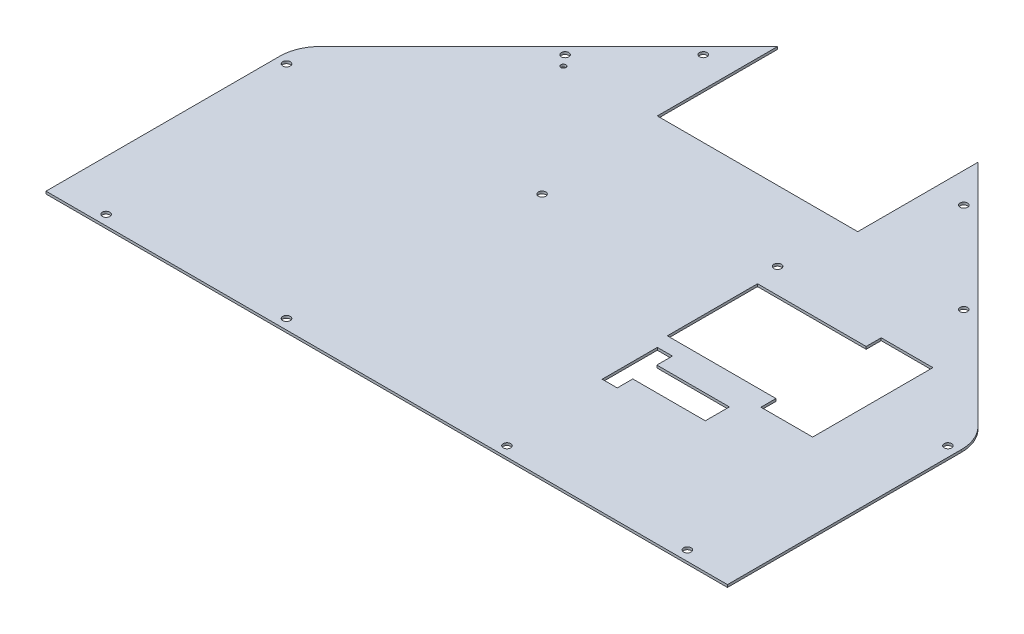
from build123d import *

# Parameters (mm, degrees)
EXTRUDE1_DEPTH     = 1.5875
MIRROR1_DEPTH      = 1.5875
CUT_EXTRUDE1_REACH = 534.229
SKETCH3_R          = 1.5875
CUT_EXTRUDE2_DEPTH = 533.229351555
SKETCH4_R          = 2.38125
SKETCH4_R_2        = 2.381250001
CUT_EXTRUDE3_DEPTH = 533.229351555
CUT_EXTRUDE4_DEPTH = 533.229351555
FILLET1_R          = 25.4


# Read off the part's stored shape, not the designer's step: Mirror1
with BuildPart() as part:
    # Sketch1 → Extrude1 (new body)
    with BuildSketch(Plane(origin=(0, 0, 0), x_dir=(1, 0, 0), z_dir=(0, 1, 0))):
        Polygon((0, 0), (0, 158.75), (152.4, 311.15), (152.4, 234.95), (215.9, 234.95), (215.9, 0), align=None)
    extrude(amount=EXTRUDE1_DEPTH)

    # Mirror1 outline → Mirror1 (add)
    with BuildSketch(Plane(origin=(0, 0, 0), x_dir=(1, 0, 0), z_dir=(0, 1, 0))):
        Polygon((215.9, 0), (431.8, 0), (431.8, 158.75), (279.4, 311.15), (279.4, 234.95), (215.9, 234.95), align=None)
    extrude(amount=MIRROR1_DEPTH)

    # Sketch2 → Cut-Extrude1 (cut, up to next)
    with BuildSketch(Plane(origin=(0, 1.5875, 0), x_dir=(-1, 0, 0), z_dir=(0, 1, 0)), mode=Mode.PRIVATE) as cut_extrude1_sk1:
        Polygon((-276.225, -174.625), (-345.059, -174.625), (-345.059, -184.15), (-377.825, -184.15), (-377.825, -107.95), (-345.059, -107.95), (-345.059, -117.475), (-276.225, -117.475), align=None)
    cut_extrude1_tool1 = extrude(cut_extrude1_sk1.sketch, amount=-CUT_EXTRUDE1_REACH, mode=Mode.PRIVATE) & part.part
    add(cut_extrude1_tool1.solids().sort_by_distance((330.365702, 1.5875, -146.05))[0], mode=Mode.SUBTRACT)

    # Sketch3 → Cut-Extrude2 (cut, through all)
    with BuildSketch(Plane.XZ):
        with Locations(Location((95.31871999, -232.5161053, 0), (0, 0, 270))):
            Circle(SKETCH3_R)
    extrude(amount=-CUT_EXTRUDE2_DEPTH, mode=Mode.SUBTRACT)

    # Sketch4 → Cut-Extrude3 (cut, through all)
    with BuildSketch(Plane.XZ):
        with Locations(Location((133.35, -283.119743879, 0), (0, 0, 270))):
            Circle(SKETCH4_R)
        with Locations(Location((273.05, -190.5, 0), (0, 0, 270))):
            Circle(SKETCH4_R)
        with Locations(Location((158.75, -155.575, 0), (0, 0, 270))):
            Circle(SKETCH4_R)
        with Locations(Location((298.45, -283.119743879, 0), (0, 0, 270))):
            Circle(SKETCH4_R)
        with Locations(Location((355.732177028, -225.837566851, 0), (0, 0, 270))):
            Circle(SKETCH4_R_2)
        with Locations(Location((425.45, -146.05, 0), (0, 0, 270))):
            Circle(SKETCH4_R)
        with Locations(Location((400.05, -6.35, 0), (0, 0, 270))):
            Circle(SKETCH4_R)
        with Locations(Location((31.75, -6.35, 0), (0, 0, 270))):
            Circle(SKETCH4_R)
        with Locations(Location((146.05, -6.35, 0), (0, 0, 270))):
            Circle(SKETCH4_R)
        with Locations(Location((285.75, -6.35, 0), (0, 0, 270))):
            Circle(SKETCH4_R)
        with Locations(Location((6.35, -146.05, 0), (0, 0, 270))):
            Circle(SKETCH4_R)
        with Locations(Location((89.563891484, -239.333635363, 0), (0, 0, 270))):
            Circle(SKETCH4_R)
    extrude(amount=-CUT_EXTRUDE3_DEPTH, mode=Mode.SUBTRACT)

    # Sketch5 → Cut-Extrude4 (cut, through all)
    with BuildSketch(Plane.XZ):
        Polygon((279.4, -107.9627), (279.4, -73.0123), (288.9504, -73.0123), (288.9504, -82.8675), (334.899, -82.8675), (334.899, -98.1075), (288.9504, -98.1075), (288.9504, -107.9627), align=None)
    extrude(amount=-CUT_EXTRUDE4_DEPTH, mode=Mode.SUBTRACT)

    # Fillet1
    fillet1_edges = [part.edges().sort_by_distance(p)[0] for p in [
        (0, 0.79375, -158.75),
        (431.8, 0.79375, -158.75),
    ]]
    fillet(fillet1_edges, radius=FILLET1_R)


solid = part.part
